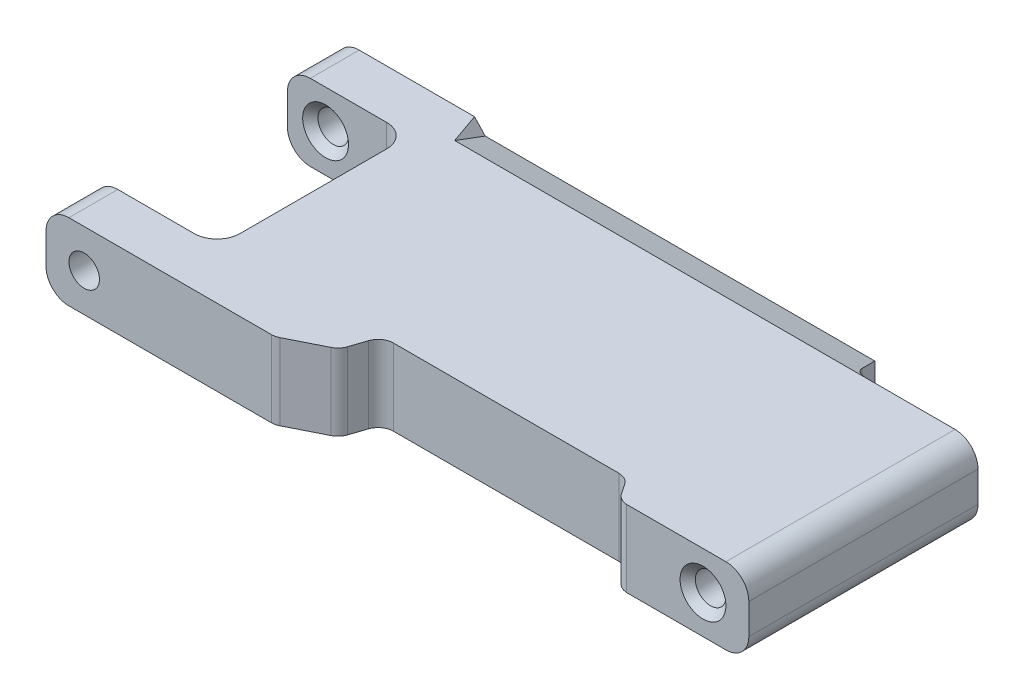
from build123d import *

# Parameters (mm, degrees)
BOSS_EXTRUDE1_DEPTH           = 10
FILLET1_R                     = 3
CUT_EXTRUDE1_DEPTH            = 55.386
CHAMFER1_SIZE                 = 1.5
MIRROR3_START                 = -3.745316975
MIRROR3_DEPTH                 = 4.272002108
CSK_FOR_M4_SFHCS1_D           = 4
CSK_FOR_M4_SFHCS1_DEPTH       = 6.4
CSK_FOR_M4_SFHCS1_CSINK_D     = 6
CSK_FOR_M4_SFHCS1_CSINK_ANGLE = 90
CSK_FOR_M4_SFHCS2_D           = 4
CSK_FOR_M4_SFHCS2_CSINK_D     = 6
CSK_FOR_M4_SFHCS2_CSINK_ANGLE = 90
SKETCH7_R                     = 1.5
CUT_EXTRUDE2_DEPTH            = 24


# Read off the part's stored shape, not the designer's step: Mirror3
with BuildPart() as part:
    # Sketch1 → Boss-Extrude1 (new body)
    with BuildSketch(Plane(origin=(0, 0, 0), x_dir=(1, 0, 0), z_dir=(0, 1, 0))):
        with BuildLine():
            Line((-35.25, 0), (-35.25, -6.4))
            Line((-35.25, -6.4), (-22.25, -6.4))
            ThreePointArc((-22.25, -6.4), (-20.128679656, -7.278679656), (-19.25, -9.4))
            Line((-19.25, -9.4), (-19.25, -28.6))
            ThreePointArc((-19.25, -28.6), (-20.128679656, -30.721320344), (-22.25, -31.6))
            Line((-22.25, -31.6), (-35.25, -31.6))
            Line((-35.25, -31.6), (-35.25, -38))
            Line((-35.25, -38), (-5.75, -38))
            ThreePointArc((-5.75, -38), (-5.289009014, -37.946146786), (-4.852843875, -37.787487311))
            Line((-4.852843875, -37.787487311), (-0.384125597, -35.544596998))
            ThreePointArc((-0.384125597, -35.544596998), (0.230625744, -35.066359782), (0.616084961, -34.389564956))
            Line((0.616084961, -34.389564956), (1.30066574, -32.33582167))
            ThreePointArc((1.30066574, -32.33582167), (2.028611742, -31.34579265), (3.198032424, -30.968276939))
            Line((3.198032424, -30.968276939), (32.698032424, -30.968276939))
            ThreePointArc((32.698032424, -30.968276939), (33.642903174, -31.205546312), (34.363585035, -31.861057674))
            Line((34.363585035, -31.861057674), (35.193999483, -33.110222133))
            ThreePointArc((35.193999483, -33.110222133), (35.866740637, -33.73918414), (36.750000973, -34.000000252))
            Line((36.750000973, -34.000000252), (52.750000973, -34.000000252))
            Line((52.750000973, -34.000000252), (52.750000973, -4.000000252))
            Line((52.750000973, -4.000000252), (38.13600074, -4.000000252))
            ThreePointArc((38.13600074, -4.000000252), (36.996810987, -3.643851433), (36.263342318, -2.702246958))
            Line((36.263342318, -2.702246958), (35.25, 0))
            Line((35.25, 0), (-35.25, 0))
        make_face()
    extrude(amount=BOSS_EXTRUDE1_DEPTH)

    # Fillet1
    fillet1_edges = [part.edges().sort_by_distance(p)[0] for p in [
        (52.750000973, 0, 19.000000252),
        (-35.25, 0, 34.8),
        (-35.25, 0, 3.2),
        (-35.25, 10, 34.8),
        (52.750000973, 10, 19.000000252),
        (-35.25, 10, 3.2),
    ]]
    fillet(fillet1_edges, radius=FILLET1_R)

    # Sketch2 → Cut-Extrude1 (cut)
    with BuildSketch(Plane(origin=(38.13600074, 0, 0), x_dir=(0, 0, -1), z_dir=(1, 0, 0))):
        Polygon((-4.000000252, 10), (0, 10), (0, 8.5), align=None)
    extrude(amount=-CUT_EXTRUDE1_DEPTH, mode=Mode.SUBTRACT)

    # Chamfer1
    # the kernel refuses this chamfer: 1.5 mm, written as the material it adds along each edge
    with BuildSketch(Plane(origin=(-17.24999926, 7.145532803, -3.611912754), x_dir=(-0.027495876610586757, 0.9359751746095561, -0.35099066837171944), z_dir=(0, 0.3511234221997007, 0.9363291848398034))) as chamfer1_piece_1_section:
        Polygon((CHAMFER1_SIZE * 0.999621916911, -CHAMFER1_SIZE * 0.0274958766106), (-CHAMFER1_SIZE * 0.0274958766106, -CHAMFER1_SIZE * 0.999621916911), (0, 0), align=None)
    chamfer1_piece_1 = extrude(amount=11.987051072, mode=Mode.PRIVATE)
    chamfer1_piece_1 = split(chamfer1_piece_1, bisect_by=Plane(origin=(-16.68097762, 9.443284972, 0), z_dir=(0, 0, 1)), keep=Keep.TOP, mode=Mode.PRIVATE)
    chamfer1_piece_1 = split(chamfer1_piece_1, bisect_by=Plane(origin=(-16.68097762, 10, 1.484573502), z_dir=(0, -1, 0)), keep=Keep.TOP, mode=Mode.PRIVATE)
    add(chamfer1_piece_1)

    # Mirror3 outline → Mirror3 (cut)
    with BuildSketch(Plane(origin=(0, 0, 0), x_dir=(1, 0, 0), z_dir=(0, 0.3511234221997011, -0.9363291848398033)).offset(MIRROR3_START)):
        Polygon((-15.74999926, -1.404493777), (40, -1.404493777), (40, 2), (-19, 2), (-19, 1.845506963), align=None)
    extrude(amount=MIRROR3_DEPTH, mode=Mode.SUBTRACT)

    # CSK for M4 SFHCS1
    with Locations(Plane.XY.offset(6.4)):
        with Locations((-30.25, 5)):
            csk_for_m4_sfhcs1 = CounterSinkHole(CSK_FOR_M4_SFHCS1_D / 2, CSK_FOR_M4_SFHCS1_CSINK_D / 2, depth=CSK_FOR_M4_SFHCS1_DEPTH, counter_sink_angle=CSK_FOR_M4_SFHCS1_CSINK_ANGLE)

    # Mirror1: CSK for M4 SFHCS1 across plane
    add(csk_for_m4_sfhcs1.mirror(Plane.XY.offset(19)), mode=Mode.SUBTRACT)

    # CSK for M4 SFHCS2 (through all)
    with Locations(Plane.XY.offset(34.000000252)):
        with Locations((46.750000973, 5)):
            csk_for_m4_sfhcs2 = CounterSinkHole(CSK_FOR_M4_SFHCS2_D / 2, CSK_FOR_M4_SFHCS2_CSINK_D / 2, counter_sink_angle=CSK_FOR_M4_SFHCS2_CSINK_ANGLE)

    # Mirror2: CSK for M4 SFHCS2 across plane
    add(csk_for_m4_sfhcs2.mirror(Plane.XY.offset(19)), mode=Mode.SUBTRACT)

    # Sketch7 → Cut-Extrude2 (cut)
    with BuildSketch(Plane(origin=(0, 0, 0), x_dir=(-1, 0, 0), z_dir=(0, 0, -1))):
        with Locations((-31.25, 5)):
            Circle(SKETCH7_R)
        with Locations((-23.75, 5)):
            Circle(SKETCH7_R)
        with Locations((-16.25, 5)):
            Circle(SKETCH7_R)
        with Locations((-8.75, 5)):
            Circle(SKETCH7_R)
        with Locations((-1.25, 5)):
            Circle(SKETCH7_R)
        with Locations((6.25, 5)):
            Circle(SKETCH7_R)
        with Locations((13.75, 5)):
            Circle(SKETCH7_R)
    extrude(amount=-CUT_EXTRUDE2_DEPTH, mode=Mode.SUBTRACT)


solid = part.part
